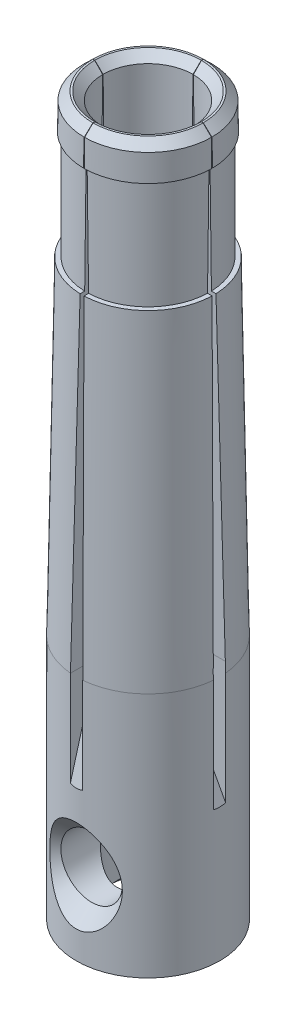
from build123d import *
from OCP.BRepFilletAPI import BRepFilletAPI_MakeChamfer

# Parameters (mm, degrees)
SKETCH1_W               = 3.5
SKETCH1_H               = 12
SKETCH2_R               = 2.2
CUT_EXTRUDE1_DEPTH      = 23
SKETCH3_R               = 2
CUT_EXTRUDE2_DEPTH      = 9
CUT_EXTRUDE3_DEPTH      = 36.864327681
CUT_EXTRUDE4_DEPTH      = 36.864327798
CUT_EXTRUDE5_DEPTH      = 0.3
CUT_EXTRUDE5_DEPTH_BACK = 0.3
CUT_EXTRUDE8_DEPTH      = 0.3
CUT_EXTRUDE8_DEPTH_BACK = 0.3
CUT_EXTRUDE7_START      = 5.3
SKETCH15_R              = 3.5
SKETCH15_R_2            = 3
CUT_EXTRUDE7_DEPTH      = 5.3
CHAMFER1_SIZE           = 0.4
CHAMFER1_SIZE2          = 0.407141204


# Read off the part's stored shape, not the designer's step: CSK for M3 Oval Head Machine Screw1
with BuildPart() as part:
    # Sketch1 → Revolve1 (revolve)
    with BuildSketch(Plane.XY):
        Polygon((0, 12), (3.5, 12), (3.1, 35), (0, 35), align=None)
        with Locations((1.75, 6)):
            Rectangle(SKETCH1_W, SKETCH1_H)
    revolve(axis=Axis((0, 0, 0), (0, 1, 0)))

    # Sketch2 → Cut-Extrude1 (cut)
    with BuildSketch(Plane(origin=(0, 35, 0), x_dir=(1, 0, 0), z_dir=(0, 1, 0))):
        with Locations(Location((0, 0, 0), (0, 0, 270))):
            Circle(SKETCH2_R)
    extrude(amount=-CUT_EXTRUDE1_DEPTH, mode=Mode.SUBTRACT)

    # Sketch3 → Cut-Extrude2 (cut)
    with BuildSketch(Plane.XZ):
        with Locations(Location((0, -0.502631205, 0), (0, 0, 270))):
            Circle(SKETCH3_R)
    extrude(amount=-CUT_EXTRUDE2_DEPTH, mode=Mode.SUBTRACT)

    # Sketch5 → Cut-Extrude3 (cut, through all)
    with BuildSketch(Plane.ZY.offset(3.5)):
        Polygon((0.3, 12), (-0.3, 12), (-0.005, 35), (0.005, 35), align=None)
    extrude(amount=-CUT_EXTRUDE3_DEPTH, mode=Mode.SUBTRACT)

    # Sketch9 → Cut-Extrude4 (cut, through all)
    with BuildSketch(Plane.XY.offset(3.5)):
        Polygon((0.305, 12), (-0.295, 12), (0, 35), (0.01, 35), align=None)
    extrude(amount=-CUT_EXTRUDE4_DEPTH, mode=Mode.SUBTRACT)

    # Sketch11 → Cut-Extrude5 (cut, two sides: drawn at the far end of the back side and taken through both)
    with BuildSketch(Plane.XY.offset(-CUT_EXTRUDE5_DEPTH_BACK)):
        Polygon((-0.249466739, 12.5), (-3.597980128, 12.5), (-3.500702869, 6.5), align=None)
        Polygon((3.597980128, 12.5), (3.500702869, 6.5), (0.249466739, 12.5), align=None)
    extrude(amount=CUT_EXTRUDE5_DEPTH + CUT_EXTRUDE5_DEPTH_BACK, mode=Mode.SUBTRACT)

    # Sketch22 → Cut-Extrude8 (cut, two sides: drawn at the far end of the back side and taken through both)
    with BuildSketch(Plane(origin=(0, 0, 0), x_dir=(0, 0, -1), z_dir=(1, 0, 0)).offset(-CUT_EXTRUDE8_DEPTH_BACK)):
        Polygon((3.5, 7.3), (2.2, 12), (3.618391535, 12), align=None)
        Polygon((-2.2, 12), (-3.5, 12), (-3.5, 7.3), align=None)
    extrude(amount=CUT_EXTRUDE8_DEPTH + CUT_EXTRUDE8_DEPTH_BACK, mode=Mode.SUBTRACT)

    # Sketch15 → Cut-Extrude7 (cut)
    with BuildSketch(Plane(origin=(0, 28, 0), x_dir=(1, 0, 0), z_dir=(0, 1, 0)).offset(CUT_EXTRUDE7_START)):
        Circle(SKETCH15_R)
        Circle(SKETCH15_R_2, mode=Mode.SUBTRACT)
    extrude(amount=-CUT_EXTRUDE7_DEPTH, mode=Mode.SUBTRACT)

    # CSK for M3 Oval Head Machine Screw1 outl → CSK for M3 Oval Head Machine Screw1 (revolve, cut)
    with BuildSketch(Plane.XZ.offset(-3.6)):
        Polygon((0, 0.819848747), (1.5, 0.819848747), (1.5, 2.75), (2.250138013, 3.500138013), (0, 3.500138013), align=None)
    revolve(axis=Axis((0, 3.6, 0), (0, 0, 1)), mode=Mode.SUBTRACT)

    # Chamfer1: one chamfer whose edges measure the first distance from different faces: ONE call of the kernel's chamfer builder (chamfer() names one face for all edges)
    chamfer1_edges_1 = [part.edges().sort_by_distance(p)[0] for p in [
        (-2.190262541, 35, 2.193798076),
    ]]
    chamfer1_side_1 = [part.faces().sort_by_distance(p)[0] for p in [
        (-2.200706991, 34.15, 2.204259386),
    ]]
    chamfer1_edges_2 = [part.edges().sort_by_distance(p)[0] for p in [
        (2.193798081, 35, 2.190262537),
    ]]
    chamfer1_side_2 = [part.faces().sort_by_distance(p)[0] for p in [
        (2.20425939, 34.15, 2.200706986),
    ]]
    chamfer1_edges_3 = [part.edges().sort_by_distance(p)[0] for p in [
        (2.193798081, 35, -2.190262537),
    ]]
    chamfer1_side_3 = [part.faces().sort_by_distance(p)[0] for p in [
        (2.20425939, 34.15, -2.200706986),
    ]]
    chamfer1_edges_4 = [part.edges().sort_by_distance(p)[0] for p in [
        (-2.190262541, 35, -2.193798076),
    ]]
    chamfer1_side_4 = [part.faces().sort_by_distance(p)[0] for p in [
        (-2.200706991, 34.15, -2.204259386),
    ]]
    chamfer1_edges_5 = [part.edges().sort_by_distance(p)[0] for p in [
        (-1.553866146, 35, 1.557401682),
        (1.557401691, 35, 1.553866137),
        (1.557401691, 35, -1.553866137),
        (-1.553866146, 35, -1.557401682),
        (0, 0, 1.497368795),
    ]]
    chamfer1 = BRepFilletAPI_MakeChamfer(part.part.solid().wrapped)
    for e in chamfer1_edges_1:
        chamfer1.Add(CHAMFER1_SIZE, CHAMFER1_SIZE2, e.wrapped, chamfer1_side_1[0].wrapped)  # the first distance lies on this face
    for e in chamfer1_edges_2:
        chamfer1.Add(CHAMFER1_SIZE, CHAMFER1_SIZE2, e.wrapped, chamfer1_side_2[0].wrapped)  # the first distance lies on this face
    for e in chamfer1_edges_3:
        chamfer1.Add(CHAMFER1_SIZE, CHAMFER1_SIZE2, e.wrapped, chamfer1_side_3[0].wrapped)  # the first distance lies on this face
    for e in chamfer1_edges_4:
        chamfer1.Add(CHAMFER1_SIZE, CHAMFER1_SIZE2, e.wrapped, chamfer1_side_4[0].wrapped)  # the first distance lies on this face
    for e in chamfer1_edges_5:
        chamfer1.Add(CHAMFER1_SIZE, e.wrapped)
    add(Compound.cast(chamfer1.Shape()), mode=Mode.REPLACE)


solid = part.part
